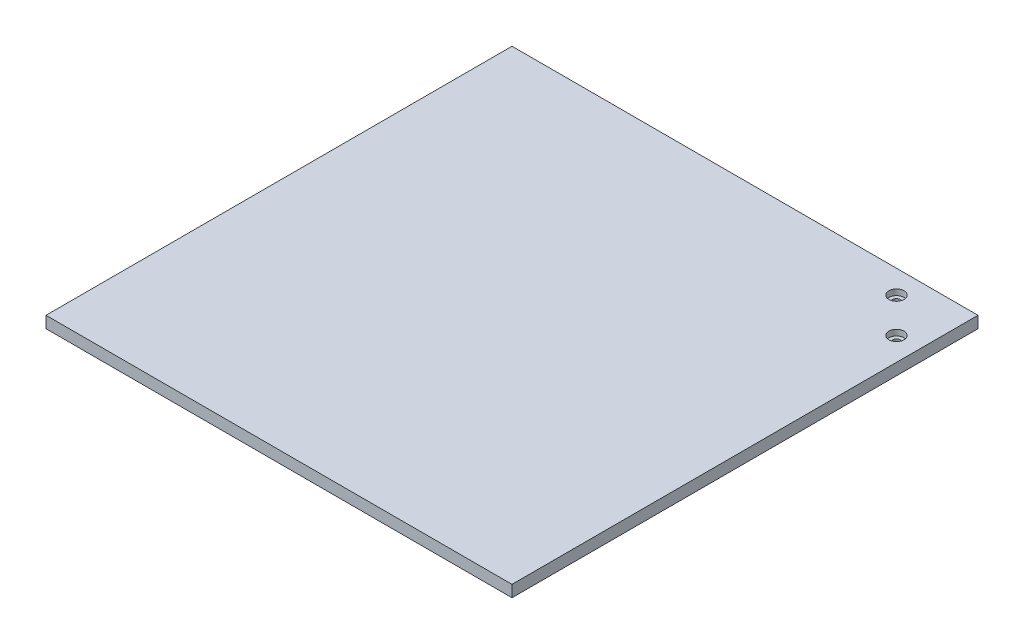
from build123d import *

# Parameters (mm, degrees)
SKETCH1_W                                     = 200
SKETCH1_H                                     = 200
BASE_PLATE_DEPTH                              = 5
CBORE_START                                   = 2.5
CBORE_FOR_M3_HEX_SOCKET_HEAD_CAP_SCR_2_R      = 3.25
CBORE_FOR_M3_HEX_SOCKET_HEAD_CAP_SCREW1_DEPTH = 2.5
CBORE_FOR_M3_HEX_SOCKET_HEAD_CAP_SCR_3_O_R    = 1.7
CBORE_FOR_M3_HEX_SOCKET_HEAD_CAP_SCR_3_DEPTH  = 2.5


# Read off the part's stored shape, not the designer's step: CBORE for M3 Hex Socket Head Cap Screw1
with BuildPart() as part:
    # Sketch1 → base_plate (new body)
    with BuildSketch(Plane(origin=(0, 0, 0), x_dir=(1, 0, 0), z_dir=(0, 1, 0))):
        Rectangle(SKETCH1_W, SKETCH1_H)
    extrude(amount=BASE_PLATE_DEPTH)

    # CBORE for M3 Hex Socket Head Cap Scr 2 → CBORE for M3 Hex Socket Head Cap Screw1 (cut)
    with BuildSketch(Plane(origin=(0, 0, 0), x_dir=(1, 0, 0), z_dir=(0, 1, 0)).offset(CBORE_START)):
        with Locations((90, 75)):
            Circle(CBORE_FOR_M3_HEX_SOCKET_HEAD_CAP_SCR_2_R)
        with Locations((75, 90)):
            Circle(CBORE_FOR_M3_HEX_SOCKET_HEAD_CAP_SCR_2_R)
    extrude(amount=CBORE_FOR_M3_HEX_SOCKET_HEAD_CAP_SCREW1_DEPTH, mode=Mode.SUBTRACT)

    # CBORE for M3 Hex Socket Head Cap Scr 3 o → CBORE for M3 Hex Socket Head Cap Scr 3 (cut)
    with BuildSketch(Plane(origin=(0, 0, 0), x_dir=(1, 0, 0), z_dir=(0, 1, 0))):
        with Locations((90, 75)):
            Circle(CBORE_FOR_M3_HEX_SOCKET_HEAD_CAP_SCR_3_O_R)
        with Locations((75, 90)):
            Circle(CBORE_FOR_M3_HEX_SOCKET_HEAD_CAP_SCR_3_O_R)
    extrude(amount=CBORE_FOR_M3_HEX_SOCKET_HEAD_CAP_SCR_3_DEPTH, mode=Mode.SUBTRACT)


solid = part.part
